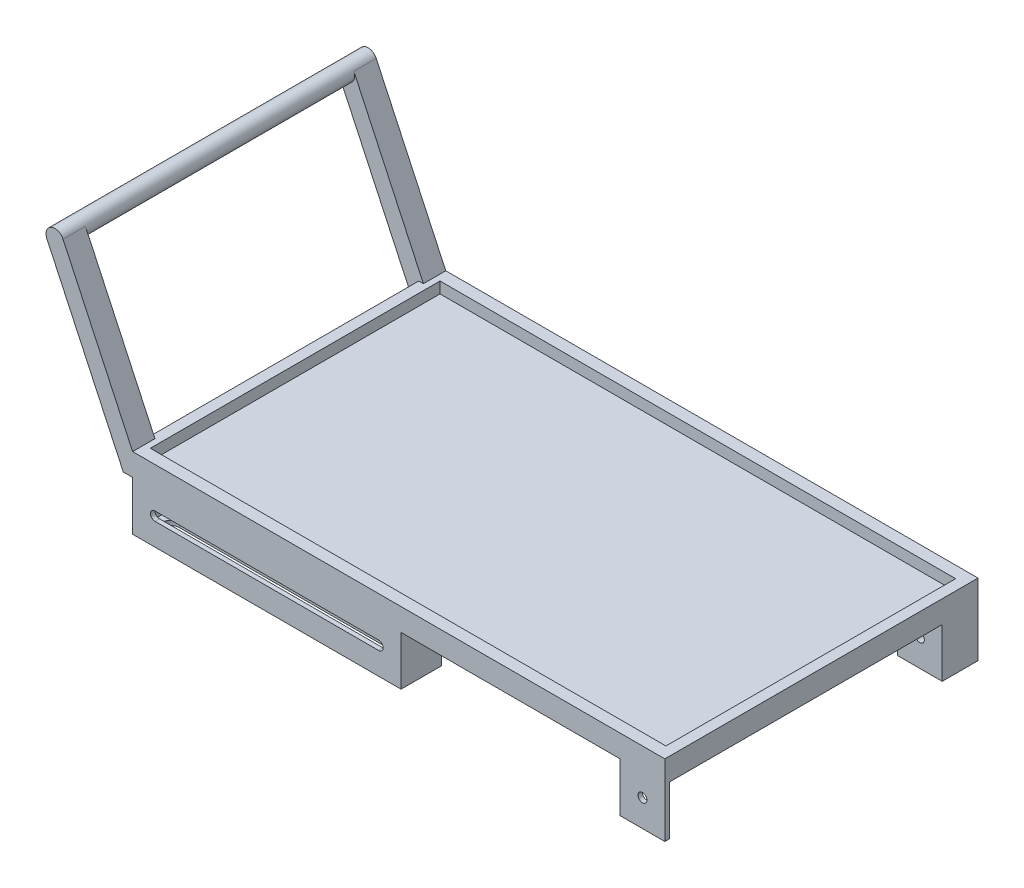
from build123d import *

# Parameters (mm, degrees)
SKETCH1_W            = 120
SKETCH1_H            = 70
BOSS_EXTRUDE1_DEPTH  = 5
BOSS_EXTRUDE4_DEPTH  = 5
BOSS_EXTRUDE5_DEPTH  = 5
BOSS_EXTRUDE7_START  = -70
SKETCH7_R            = 2
BOSS_EXTRUDE7_DEPTH  = 70
SKETCH8_W            = 115.247199032
SKETCH8_H            = 64.754368984
CUT_EXTRUDE1_DEPTH   = 2.5
SKETCH13_W           = 10
SKETCH13_H           = 10
BOSS_EXTRUDE8_DEPTH  = 1
SKETCH14_W           = 10
SKETCH14_H           = 10
BOSS_EXTRUDE9_DEPTH  = 1
SKETCH15_W           = 60
SKETCH15_H           = 10
BOSS_EXTRUDE12_DEPTH = 1
CUT_EXTRUDE2_REACH   = 114.225
CUT_EXTRUDE3_START   = -70
SKETCH17_R           = 1
CUT_EXTRUDE3_DEPTH   = 70
SKETCH18_W           = 60
SKETCH18_H           = 9
BOSS_EXTRUDE15_DEPTH = 1
THICKEN1_START       = 0.540986693
THICKEN1_OUTLINE_W   = 10
THICKEN1_OUTLINE_H   = 8
THICKEN1_DEPTH       = 0.5
THICKEN2_START       = -58.959013307
THICKEN2_OUTLINE_W   = 10
THICKEN2_OUTLINE_H   = 8
THICKEN2_DEPTH       = 0.5
THICKEN3_START       = -58.959013307
THICKEN3_OUTLINE_W   = 10
THICKEN3_OUTLINE_H   = 8
THICKEN3_DEPTH       = 0.5
THICKEN4_START       = 0.540986693
THICKEN4_OUTLINE_W   = 10
THICKEN4_OUTLINE_H   = 8
THICKEN4_DEPTH       = 0.5
SKETCH22_W           = 10
SKETCH22_H           = 1
BOSS_EXTRUDE16_DEPTH = 1
SKETCH23_W           = 10
SKETCH23_H           = 1
BOSS_EXTRUDE17_DEPTH = 1
CUT_EXTRUDE4_DEPTH   = 5
SKETCH28_W           = 10
SKETCH28_H           = 11
BOSS_EXTRUDE18_DEPTH = 8
CUT_EXTRUDE5_START   = -23
SKETCH29_R           = 1
CUT_EXTRUDE5_DEPTH   = 23


# Read off the part's stored shape, not the designer's step: Thicken1, Thicken2, Thicken3, Thicken4
with BuildPart() as part:
    # Sketch1 → Boss-Extrude1 (new body)
    with BuildSketch(Plane(origin=(0, 0, 0), x_dir=(1, 0, 0), z_dir=(0, 1, 0))):
        Rectangle(SKETCH1_W, SKETCH1_H)
    extrude(amount=BOSS_EXTRUDE1_DEPTH)

    # Sketch2 → Boss-Extrude4 (add)
    with BuildSketch(Plane(origin=(0, 0, -35), x_dir=(-1, 0, 0), z_dir=(0, 0, -1))):
        Polygon((74.508152461, 38.345236523), (58.959013307, 5), (60, 5), (60, -0.000631219), (61.04069235, -0.000631219), (78.133383609, 36.654763477), align=None)
    extrude(amount=-BOSS_EXTRUDE4_DEPTH)

    # Sketch6 → Boss-Extrude5 (add)
    with BuildSketch(Plane.XY.offset(35)):
        Polygon((-61.04069235, -0.000631219), (-60, 0), (-60, 5), (-58.959013307, 5), (-74.508152461, 38.345236523), (-78.133383609, 36.654763477), align=None)
    extrude(amount=-BOSS_EXTRUDE5_DEPTH)

    # Sketch7 → Boss-Extrude7 (add)
    with BuildSketch(Plane(origin=(0, 0, -35), x_dir=(-1, 0, 0), z_dir=(0, 0, -1)).offset(BOSS_EXTRUDE7_START)):
        with Locations(Location((76.320768035, 37.5, 0), (0, 0, 335))):
            Circle(SKETCH7_R)
    extrude(amount=BOSS_EXTRUDE7_DEPTH)

    # Sketch8 → Cut-Extrude1 (cut)
    with BuildSketch(Plane(origin=(0, 5, 0), x_dir=(1, 0, 0), z_dir=(0, 1, 0))):
        Rectangle(SKETCH8_W, SKETCH8_H)
    extrude(amount=-CUT_EXTRUDE1_DEPTH, mode=Mode.SUBTRACT)

    # Sketch13 → Boss-Extrude8 (add)
    with BuildSketch(Plane(origin=(0, 0, -35), x_dir=(-1, 0, 0), z_dir=(0, 0, -1))):
        with Locations((-55, -5)):
            Rectangle(SKETCH13_W, SKETCH13_H)
    extrude(amount=-BOSS_EXTRUDE8_DEPTH)

    # Sketch14 → Boss-Extrude9 (add)
    with BuildSketch(Plane.XY.offset(35)):
        with Locations((55, -5)):
            Rectangle(SKETCH14_W, SKETCH14_H)
    extrude(amount=-BOSS_EXTRUDE9_DEPTH)

    # Sketch15 → Boss-Extrude12 (add)
    with BuildSketch(Plane(origin=(0, 0, -35), x_dir=(-1, 0, 0), z_dir=(0, 0, -1))):
        with Locations((28.959013307, -5)):
            Rectangle(SKETCH15_W, SKETCH15_H)
    boss_extrude12 = extrude(amount=-BOSS_EXTRUDE12_DEPTH)

    # Mirror1: Boss-Extrude12 across plane
    add(boss_extrude12.mirror(Plane.XY))

    # Cut-Extrude2: up to this face of the body (flat: up to its plane)
    cut_extrude2_end = Plane(part.part.faces().sort_by_distance((-15.670325555, 0.904669602, 35))[0])
    # Sketch16 → Cut-Extrude2 (cut, up to the picked face)
    with BuildSketch(Plane(origin=(0, 0, -35), x_dir=(-1, 0, 0), z_dir=(0, 0, -1)), mode=Mode.PRIVATE) as cut_extrude2_sk1:
        with BuildLine():
            Line((3.959013307, -4), (53.959013307, -4))
            ThreePointArc((53.959013307, -4), (54.959013307, -5), (53.959013307, -6))
            Line((53.959013307, -6), (3.959013307, -6))
            ThreePointArc((3.959013307, -6), (2.959013307, -5), (3.959013307, -4))
        make_face()
    cut_extrude2_tool1 = split(extrude(cut_extrude2_sk1.sketch, amount=-CUT_EXTRUDE2_REACH, mode=Mode.PRIVATE), bisect_by=cut_extrude2_end, keep=Keep.BOTH, mode=Mode.PRIVATE)
    add(cut_extrude2_tool1.solids().sort_by(Axis((-28.959013, -5, -35), (0, 0, 1)))[0], mode=Mode.SUBTRACT)

    # Sketch17 → Cut-Extrude3 (cut)
    with BuildSketch(Plane(origin=(0, 0, -35), x_dir=(-1, 0, 0), z_dir=(0, 0, -1)).offset(CUT_EXTRUDE3_START)):
        with Locations((-55, -5)):
            Circle(SKETCH17_R)
    extrude(amount=CUT_EXTRUDE3_DEPTH, mode=Mode.SUBTRACT)

    # Sketch18 → Boss-Extrude15 (add)
    with BuildSketch(Plane.XZ.offset(10)):
        with Locations((-28.959013307, 30.5)):
            Rectangle(SKETCH18_W, SKETCH18_H)
        with Locations((-28.959013307, -30.5)):
            Rectangle(SKETCH18_W, SKETCH18_H)
    extrude(amount=BOSS_EXTRUDE15_DEPTH)

    # Thicken1 outline → Thicken1 (add)
    with BuildSketch(Plane.YZ.offset(THICKEN1_START)):
        with Locations((-5, 30)):
            Rectangle(THICKEN1_OUTLINE_W, THICKEN1_OUTLINE_H)
    extrude(amount=THICKEN1_DEPTH)

    # Thicken2 outline → Thicken2 (add)
    with BuildSketch(Plane.YZ.offset(THICKEN2_START)):
        with Locations((-5, -30)):
            Rectangle(THICKEN2_OUTLINE_W, THICKEN2_OUTLINE_H)
    extrude(amount=THICKEN2_DEPTH)

    # Thicken3 outline → Thicken3 (add)
    with BuildSketch(Plane.YZ.offset(THICKEN3_START)):
        with Locations((-5, 30)):
            Rectangle(THICKEN3_OUTLINE_W, THICKEN3_OUTLINE_H)
    extrude(amount=THICKEN3_DEPTH)

    # Thicken4 outline → Thicken4 (add)
    with BuildSketch(Plane.YZ.offset(THICKEN4_START)):
        with Locations((-5, -30)):
            Rectangle(THICKEN4_OUTLINE_W, THICKEN4_OUTLINE_H)
    extrude(amount=THICKEN4_DEPTH)

    # Sketch22 → Boss-Extrude16 (add)
    with BuildSketch(Plane.XY.offset(35)):
        with Locations((55, -10.5)):
            Rectangle(SKETCH22_W, SKETCH22_H)
    extrude(amount=-BOSS_EXTRUDE16_DEPTH)

    # Sketch23 → Boss-Extrude17 (add)
    with BuildSketch(Plane(origin=(0, 0, -35), x_dir=(-1, 0, 0), z_dir=(0, 0, -1))):
        with Locations((-55, -10.5)):
            Rectangle(SKETCH23_W, SKETCH23_H)
    extrude(amount=-BOSS_EXTRUDE17_DEPTH)

    # Sketch25 → Cut-Extrude4 (cut)
    with BuildSketch(Plane.XZ.offset(11)):
        with BuildLine():
            Line((-2.866454916, 32.5), (-54.996437016, 32.5))
            ThreePointArc((-54.996437016, 32.5), (-56.996437016, 30.5), (-54.996437016, 28.5))
            Line((-54.996437016, 28.5), (-2.866454916, 28.5))
            ThreePointArc((-2.866454916, 28.5), (-0.866454916, 30.5), (-2.866454916, 32.5))
        make_face()
        with BuildLine():
            Line((-2.866454916, -28.5), (-54.996437016, -28.5))
            ThreePointArc((-54.996437016, -28.5), (-56.996437016, -30.5), (-54.996437016, -32.5))
            Line((-54.996437016, -32.5), (-2.866454916, -32.5))
            ThreePointArc((-2.866454916, -32.5), (-0.866454916, -30.5), (-2.866454916, -28.5))
        make_face()
    extrude(amount=-CUT_EXTRUDE4_DEPTH, mode=Mode.SUBTRACT)

    # Sketch28 → Boss-Extrude18 (add)
    with BuildSketch(Plane(origin=(0, 0, -35), x_dir=(-1, 0, 0), z_dir=(0, 0, -1))):
        with Locations((-55, -5.5)):
            Rectangle(SKETCH28_W, SKETCH28_H)
    extrude(amount=-BOSS_EXTRUDE18_DEPTH)

    # Sketch29 → Cut-Extrude5 (cut)
    with BuildSketch(Plane(origin=(0, 0, -35), x_dir=(-1, 0, 0), z_dir=(0, 0, -1)).offset(CUT_EXTRUDE5_START)):
        with Locations((-55, -5)):
            Circle(SKETCH29_R)
    extrude(amount=CUT_EXTRUDE5_DEPTH, mode=Mode.SUBTRACT)


solid = part.part
